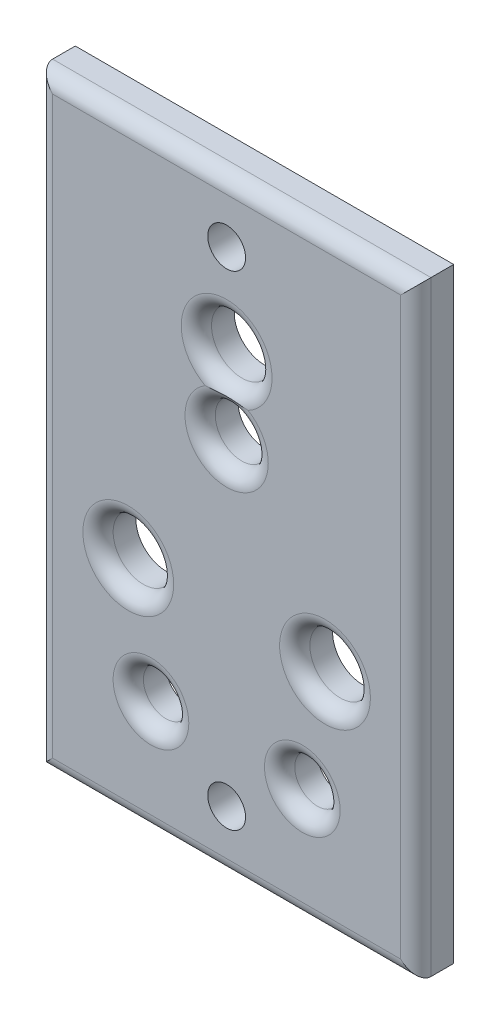
from build123d import *

# Parameters (mm, degrees)
SKETCH1_W          = 50
SKETCH1_H          = 80
EXTRUDE1_DEPTH     = 5
SKETCH2_R          = 3
SKETCH2_R_2        = 4
SKETCH2_R_3        = 3.5
CUT_EXTRUDE1_DEPTH = 48.434164903
FILLET1_R          = 2
SKETCH5_R          = 2.5
CUT_EXTRUDE2_DEPTH = 10


with BuildPart() as part:
    # Sketch1 → Extrude1 (new body)
    with BuildSketch(Plane.XY):
        Rectangle(SKETCH1_W, SKETCH1_H)
    extrude(amount=EXTRUDE1_DEPTH)

    # Sketch2 → Cut-Extrude1 (cut, through all)
    with BuildSketch(Plane.XY.offset(5)):
        with Locations((-10, -25)):
            Circle(SKETCH2_R)
        with Locations((10, -25)):
            Circle(SKETCH2_R)
        with Locations((0, 20)):
            Circle(SKETCH2_R_2)
        with Locations((13, -10.112374908)):
            Circle(SKETCH2_R_2)
        with Locations((-13, -10.112374908)):
            Circle(SKETCH2_R_2)
        with Locations((0, 10)):
            Circle(SKETCH2_R_3)
    extrude(amount=-CUT_EXTRUDE1_DEPTH, mode=Mode.SUBTRACT)

    # Fillet1
    # the kernel refuses this fillet: 2 mm, written as the material it takes off along each edge
    with BuildSketch(Plane(origin=(25, 45, 5), x_dir=(0, 0, -1), z_dir=(0, -1, 0)), Plane(origin=(-25, -45, 5), x_dir=(0, 0, -1), z_dir=(0, 1, 0))) as fillet1_piece_1:
        with BuildLine():
            CenterArc((FILLET1_R, -FILLET1_R), FILLET1_R, 90, 90)
            Line((0, -FILLET1_R), (0, 0))
            Line((0, 0), (FILLET1_R, 0))
        make_face()
    extrude(amount=90, mode=Mode.SUBTRACT)
    with BuildSketch(Plane(origin=(-30, 40, 5), x_dir=(0, 0, -1), z_dir=(1, 0, 0))) as fillet1_piece_2:
        with BuildLine():
            CenterArc((FILLET1_R, -FILLET1_R), FILLET1_R, 90, 90)
            Line((0, -FILLET1_R), (0, 0))
            Line((0, 0), (FILLET1_R, 0))
        make_face()
    extrude(amount=60, mode=Mode.SUBTRACT)
    with BuildSketch(Plane(origin=(-10, -25, 5), x_dir=(1, 0, 0), z_dir=(0, -1, 0))) as fillet1_piece_3:
        with BuildLine():
            CenterArc((3 + FILLET1_R, -FILLET1_R), FILLET1_R, 90, 90)
            Line((3, -FILLET1_R), (3, 0))
            Line((3, 0), (3 + FILLET1_R, 0))
        make_face()
    revolve(axis=Axis((-10, -25, 5), (0, 0, 1)), mode=Mode.SUBTRACT)
    with BuildSketch(Plane(origin=(10, -25, 5), x_dir=(1, 0, 0), z_dir=(0, -1, 0))) as fillet1_piece_4:
        with BuildLine():
            CenterArc((3 + FILLET1_R, -FILLET1_R), FILLET1_R, 90, 90)
            Line((3, -FILLET1_R), (3, 0))
            Line((3, 0), (3 + FILLET1_R, 0))
        make_face()
    revolve(axis=Axis((10, -25, 5), (0, 0, 1)), mode=Mode.SUBTRACT)
    with BuildSketch(Plane(origin=(0, 20, 5), x_dir=(1, 0, 0), z_dir=(0, -1, 0))) as fillet1_piece_5:
        with BuildLine():
            CenterArc((4 + FILLET1_R, -FILLET1_R), FILLET1_R, 90, 90)
            Line((4, -FILLET1_R), (4, 0))
            Line((4, 0), (4 + FILLET1_R, 0))
        make_face()
    revolve(axis=Axis((0, 20, 5), (0, 0, 1)), mode=Mode.SUBTRACT)
    with BuildSketch(Plane(origin=(13, -10.112374908, 5), x_dir=(1, 0, 0), z_dir=(0, -1, 0))) as fillet1_piece_6:
        with BuildLine():
            CenterArc((4 + FILLET1_R, -FILLET1_R), FILLET1_R, 90, 90)
            Line((4, -FILLET1_R), (4, 0))
            Line((4, 0), (4 + FILLET1_R, 0))
        make_face()
    revolve(axis=Axis((13, -10.112374908, 5), (0, 0, 1)), mode=Mode.SUBTRACT)
    with BuildSketch(Plane(origin=(-13, -10.112374908, 5), x_dir=(1, 0, 0), z_dir=(0, -1, 0))) as fillet1_piece_7:
        with BuildLine():
            CenterArc((4 + FILLET1_R, -FILLET1_R), FILLET1_R, 90, 90)
            Line((4, -FILLET1_R), (4, 0))
            Line((4, 0), (4 + FILLET1_R, 0))
        make_face()
    revolve(axis=Axis((-13, -10.112374908, 5), (0, 0, 1)), mode=Mode.SUBTRACT)
    with BuildSketch(Plane(origin=(0, 10, 5), x_dir=(1, 0, 0), z_dir=(0, -1, 0))) as fillet1_piece_8:
        with BuildLine():
            CenterArc((3.5 + FILLET1_R, -FILLET1_R), FILLET1_R, 90, 90)
            Line((3.5, -FILLET1_R), (3.5, 0))
            Line((3.5, 0), (3.5 + FILLET1_R, 0))
        make_face()
    revolve(axis=Axis((0, 10, 5), (0, 0, 1)), mode=Mode.SUBTRACT)
    with BuildSketch(Plane(origin=(30, -40, 5), x_dir=(0, 1, 0), z_dir=(-1, 0, 0))) as fillet1_piece_9:
        with BuildLine():
            CenterArc((FILLET1_R, FILLET1_R), FILLET1_R, 180, 90)
            Line((0, FILLET1_R), (0, 0))
            Line((0, 0), (FILLET1_R, 0))
        make_face()
    extrude(amount=60, mode=Mode.SUBTRACT)

    # Sketch5 → Cut-Extrude2 (cut)
    with BuildSketch(Plane.XY.offset(5)):
        with Locations((0, 32)):
            Circle(SKETCH5_R)
        with Locations((0, -32)):
            Circle(SKETCH5_R)
    extrude(amount=-CUT_EXTRUDE2_DEPTH, mode=Mode.SUBTRACT)


solid = part.part
